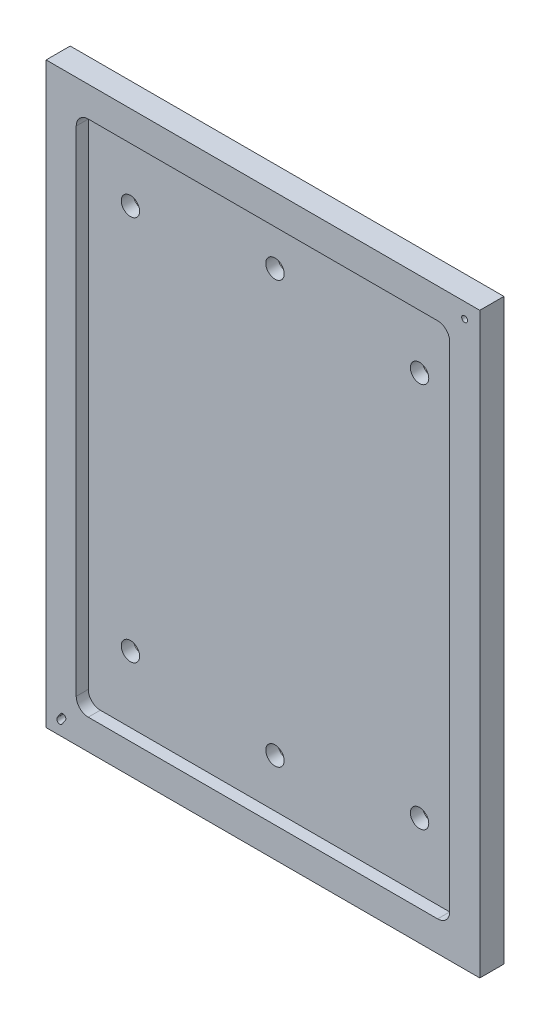
from build123d import *

# Parameters (mm, degrees)
SKETCH1_W                      = 228.6
SKETCH1_H                      = 304.8
BOSS_EXTRUDE1_DEPTH            = 12.7
CUT_EXTRUDE1_DEPTH             = 6.35
SKETCH4_R                      = 4.85
CUT_EXTRUDE2_DEPTH             = 191.605803952
F_3_1_3_1_DIAMETER_HOLE1_D     = 3.1
F_3_1_3_1_DIAMETER_HOLE1_DEPTH = 5
F_3_1_3_1_DIAMETER_HOLE1_TIP   = 0.931333959
CUT_EXTRUDE3_DEPTH             = 5
M4X0_7_TAPPED_HOLE1_D          = 3.3
M4X0_7_TAPPED_HOLE1_DEPTH      = 5.4
M4X0_7_TAPPED_HOLE1_TIP        = 0.991420021


with BuildPart() as part:
    # Sketch1 → Boss-Extrude1 (new body)
    with BuildSketch(Plane.XY):
        Rectangle(SKETCH1_W, SKETCH1_H)
    extrude(amount=BOSS_EXTRUDE1_DEPTH)

    # Sketch2 → Cut-Extrude1 (cut)
    with BuildSketch(Plane.XY.offset(12.7)):
        with BuildLine():
            Line((92.075, -136.525), (-92.075, -136.525))
            ThreePointArc((-92.075, -136.525), (-96.565128061, -134.665128061), (-98.425, -130.175))
            Line((-98.425, -130.175), (-98.425, 130.175))
            ThreePointArc((-98.425, 130.175), (-96.565128061, 134.665128061), (-92.075, 136.525))
            Line((-92.075, 136.525), (92.075, 136.525))
            ThreePointArc((92.075, 136.525), (96.565128061, 134.665128061), (98.425, 130.175))
            Line((98.425, 130.175), (98.425, -130.175))
            ThreePointArc((98.425, -130.175), (96.565128061, -134.665128061), (92.075, -136.525))
        make_face()
    extrude(amount=-CUT_EXTRUDE1_DEPTH, mode=Mode.SUBTRACT)

    # Sketch4 → Cut-Extrude2 (cut, through all)
    with BuildSketch(Plane.XY.offset(6.35)):
        with Locations((-76.2, 101.6)):
            Circle(SKETCH4_R)
        with Locations((76.2, 101.6)):
            Circle(SKETCH4_R)
        with Locations((-76.2, -101.6)):
            Circle(SKETCH4_R)
        with Locations((76.2, -101.6)):
            Circle(SKETCH4_R)
        with Locations((0, 111.125)):
            Circle(SKETCH4_R)
        with Locations((0, -111.125)):
            Circle(SKETCH4_R)
    extrude(amount=-CUT_EXTRUDE2_DEPTH, mode=Mode.SUBTRACT)

    # Ø3.1 (3.1) Diameter Hole1
    with Locations(Plane.XY.offset(12.7)):
        with Locations((106.3, 144.4)):
            Hole(F_3_1_3_1_DIAMETER_HOLE1_D / 2, depth=F_3_1_3_1_DIAMETER_HOLE1_DEPTH)
            with Locations((0, 0, -(F_3_1_3_1_DIAMETER_HOLE1_DEPTH + F_3_1_3_1_DIAMETER_HOLE1_TIP / 2))):  # 118° drill point
                Cone(0, F_3_1_3_1_DIAMETER_HOLE1_D / 2, F_3_1_3_1_DIAMETER_HOLE1_TIP, mode=Mode.SUBTRACT)

    # Sketch7 → Cut-Extrude3 (cut)
    with BuildSketch(Plane.XY.offset(12.7)):
        with BuildLine():
            Line((-108.420428502, -144.795326406), (-106.764617546, -142.29366894))
            ThreePointArc((-106.764617546, -142.29366894), (-104.616592195, -141.856648243), (-104.179571498, -144.004673594))
            Line((-104.179571498, -144.004673594), (-105.835382454, -146.50633106))
            ThreePointArc((-105.835382454, -146.50633106), (-107.983407805, -146.943351757), (-108.420428502, -144.795326406))
        make_face()
    extrude(amount=-CUT_EXTRUDE3_DEPTH, mode=Mode.SUBTRACT)

    # M4x0.7 Tapped Hole1
    with Locations(Plane(origin=(0, 0, 0), x_dir=(-1, 0, 0), z_dir=(0, 0, -1))):
        with Locations((-106.3, -102.4), (-106.3, 0), (-106.3, 113.6)):
            Hole(M4X0_7_TAPPED_HOLE1_D / 2, depth=M4X0_7_TAPPED_HOLE1_DEPTH)
            with Locations((0, 0, -(M4X0_7_TAPPED_HOLE1_DEPTH + M4X0_7_TAPPED_HOLE1_TIP / 2))):  # 118° drill point
                Cone(0, M4X0_7_TAPPED_HOLE1_D / 2, M4X0_7_TAPPED_HOLE1_TIP, mode=Mode.SUBTRACT)


solid = part.part
